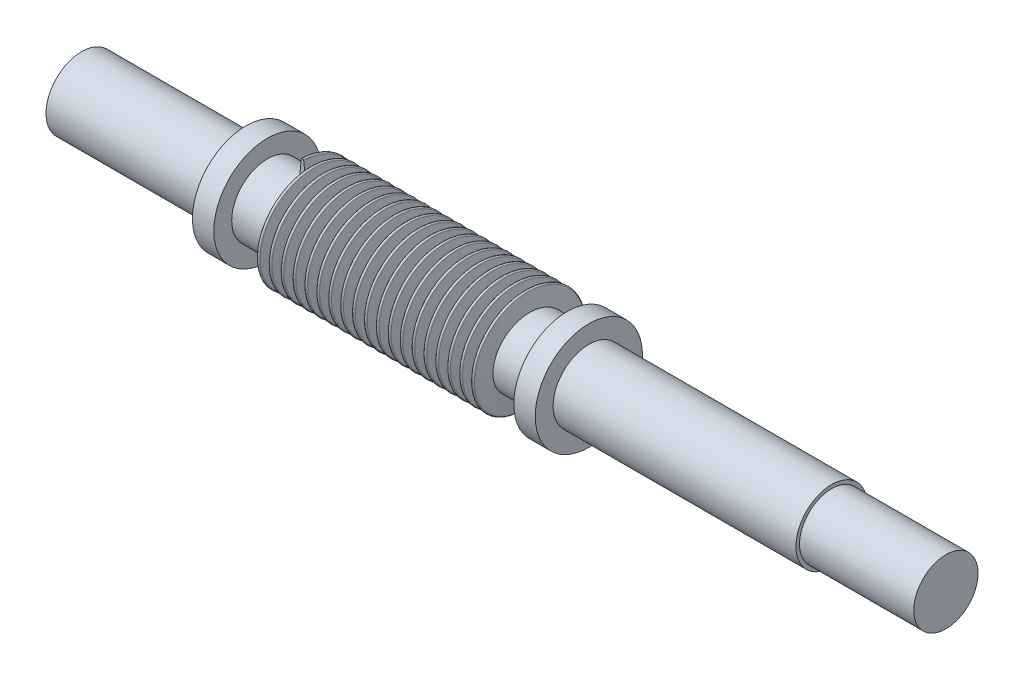
from build123d import *

# Parameters (mm, degrees)
SWEEP1_PITCH = 5


with BuildPart() as part:
    # Sketch1 → Revolve1 (revolve)
    with BuildSketch(Plane.XY, mode=Mode.PRIVATE) as revolve1_sk:
        Polygon((0, 0), (0, 15), (69, 15), (69, 22.5), (78, 22.5), (78, 15), (204, 15), (204, 22.5), (213, 22.5), (213, 15), (315, 15), (315, 13.5), (363, 13.5), (363, 0), align=None)
    revolve(revolve1_sk.sketch.rotate(Axis((0, 0, 0), (1, 0, 0)), 90), axis=Axis((0, 0, 0), (1, 0, 0)))

    # Sweep1: arcs per turn and ends read off the stored shape
    # Sweep1: the profile of Sketch4 screwed along a left-hand helix through 19.55 turns, 12 arcs to a turn; built about Z, then put on its axis
    sweep1_z = Axis((0, 0, 0), (0, 0, 1))
    sweep1_corners = [(0, -22.052569866, 1.747175507), (0, -15, 2.5), (0, -14.3, 2.5), (0, -14.3, 0), (0, -15, 0), (0, -22.052569866, 0.752824493), (0, -22.499499013, 1.25)]
    with BuildLine(mode=Mode.PRIVATE) as sweep1_profile:
        Line(sweep1_corners[0], sweep1_corners[1])
        Line(sweep1_corners[1], sweep1_corners[2])
        Line(sweep1_corners[2], sweep1_corners[3])
        Line(sweep1_corners[3], sweep1_corners[4])
        Line(sweep1_corners[4], sweep1_corners[5])
        ThreePointArc((0, -22.052569866, 0.752824493), (0, -22.371342681, 0.915736202), (0, -22.499499013, 1.25))
        ThreePointArc((0, -22.499499013, 1.25), (0, -22.371342681, 1.584263798), (0, -22.052569866, 1.747175507))
    sweep1_cap = Face(sweep1_profile.wire())
    sweep1_arcs = [((0, -22.052569866, 0.752824493), (0, -22.499499013, 0.800531813), (0, -22.499499013, 1.25), (1, 0.7436873355410438, 1)), ((0, -22.499499013, 1.25), (0, -22.499499013, 1.699468187), (0, -22.052569866, 1.747175507), (1, 0.7436873355410438, 1))]  # start, shoulder, end, weights
    sweep1_turn_angles = [0, -15, -30, -45, -60, -75, -90, -105, -120, -135, -150, -165, -180, -195, -210, -225, -240, -255, -270, -285, -300, -315, -330, -345, -360]
    sweep1_turn_weights = [1, 0.9659258262890683, 1, 0.9659258262890683, 1, 0.9659258262890683, 1, 0.9659258262890683, 1, 0.9659258262890683, 1, 0.9659258262890683, 1, 0.9659258262890683, 1, 0.9659258262890683, 1, 0.9659258262890683, 1, 0.9659258262890683, 1, 0.9659258262890683, 1, 0.9659258262890683, 1]
    sweep1_turn_rails = [Edge.make_bspline([Vector(p[0], p[1], 0).rotate(sweep1_z, sweep1_turn_angles[k]) / sweep1_turn_weights[k] + Vector(0, 0, p[2] + -SWEEP1_PITCH * sweep1_turn_angles[k] / 360) for k in range(25)], [0, 0, 0, 1, 1, 2, 2, 3, 3, 4, 4, 5, 5, 6, 6, 7, 7, 8, 8, 9, 9, 10, 10, 11, 11, 12, 12, 12], 2, sweep1_turn_weights) for p in sweep1_corners]
    sweep1_turn_sides = [*[Face.make_surface_from_curves(sweep1_turn_rails[p[0]], sweep1_turn_rails[p[1]]) for p in [(0, 1), (1, 2), (2, 3), (3, 4), (4, 5)]], *[Face.make_bezier_surface([[Vector(p[j][0], p[j][1], 0).rotate(sweep1_z, sweep1_turn_angles[2 * i + k]) / sweep1_turn_weights[2 * i + k] + Vector(0, 0, p[j][2] + -SWEEP1_PITCH * sweep1_turn_angles[2 * i + k] / 360) for k in range(3)] for j in range(3)], [[p[3][j] * sweep1_turn_weights[2 * i + k] for k in range(3)] for j in range(3)]) for p in sweep1_arcs for i in range(12)]]
    sweep1_last_angles = [-6840, -6855, -6870, -6885, -6900, -6915, -6930, -6945, -6960, -6975, -6990, -7005, -7020, -7029, -7038]
    sweep1_last_weights = [1, 0.9659258262890683, 1, 0.9659258262890683, 1, 0.9659258262890683, 1, 0.9659258262890683, 1, 0.9659258262890683, 1, 0.9659258262890683, 1, 0.9876883405951378, 1]
    sweep1_last_rails = [Edge.make_bspline([Vector(p[0], p[1], 0).rotate(sweep1_z, sweep1_last_angles[k]) / sweep1_last_weights[k] + Vector(0, 0, p[2] + -SWEEP1_PITCH * sweep1_last_angles[k] / 360) for k in range(15)], [0, 0, 0, 1, 1, 2, 2, 3, 3, 4, 4, 5, 5, 6, 6, 7, 7, 7], 2, sweep1_last_weights) for p in sweep1_corners]
    sweep1_last_sides = [*[Face.make_surface_from_curves(sweep1_last_rails[p[0]], sweep1_last_rails[p[1]]) for p in [(0, 1), (1, 2), (2, 3), (3, 4), (4, 5)]], *[Face.make_bezier_surface([[Vector(p[j][0], p[j][1], 0).rotate(sweep1_z, sweep1_last_angles[2 * i + k]) / sweep1_last_weights[2 * i + k] + Vector(0, 0, p[j][2] + -SWEEP1_PITCH * sweep1_last_angles[2 * i + k] / 360) for k in range(3)] for j in range(3)], [[p[3][j] * sweep1_last_weights[2 * i + k] for k in range(3)] for j in range(3)]) for p in sweep1_arcs for i in range(7)]]
    sweep1 = Plane(origin=(91.5, 0, 0), x_dir=(0, 0, 1), z_dir=(1, 0, 0)) * Solid(Shell([*[p.moved(Location((0, 0, SWEEP1_PITCH * i))) for i in range(19) for p in sweep1_turn_sides], *sweep1_last_sides, sweep1_cap, sweep1_cap.rotate(sweep1_z, -7038).moved(Location((0, 0, -SWEEP1_PITCH * -7038 / 360)))]))
    add(sweep1)


solid = part.part
